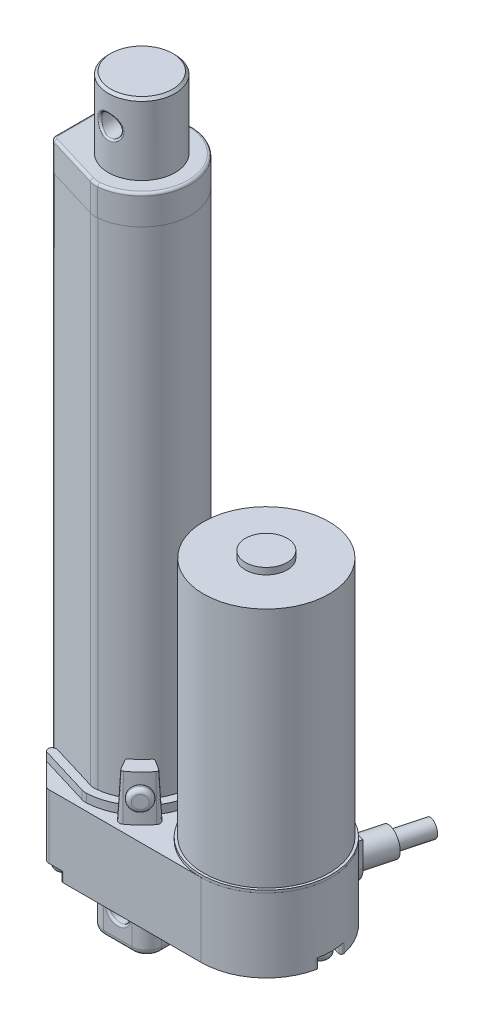
from build123d import *

# Parameters (mm, degrees)
BOSS_EXTRUDE1_DEPTH           = 22.352
BOSS_EXTRUDE2_DEPTH           = 19.05
FILLET1_R                     = 1.778
SKETCH3_R                     = 3.2385
CUT_EXTRUDE1_DEPTH            = 17.526
FILLET2_R                     = 0.635
CUT_EXTRUDE2_DEPTH            = 2.9464
FILLET3_R                     = 0.635
SKETCH5_R                     = 3.048
BOSS_EXTRUDE3_DEPTH           = 2.9464
FILLET4_R                     = 1.27
SKETCH6_R                     = 19.812
BOSS_EXTRUDE4_DEPTH           = 0.762
SKETCH7_R                     = 19.05
BOSS_EXTRUDE5_DEPTH           = 73.406
SKETCH8_R                     = 6.35
BOSS_EXTRUDE6_DEPTH           = 1.9812
BOSS_EXTRUDE8_DEPTH           = 2.54
BOSS_EXTRUDE9_DEPTH           = 13.462
BOSS_EXTRUDE9_DRAFT           = 3
BOSS_EXTRUDE9_PROFILE_2_DEPTH = 13.462
BOSS_EXTRUDE9_PROFILE_2_DRAFT = 3
FILLET6_R                     = 5.08
FILLET7_R                     = 1.905
BOSS_EXTRUDE10_DEPTH          = 152.781
BOSS_EXTRUDE11_START          = -1.27
SKETCH17_R                    = 1.905
BOSS_EXTRUDE11_DEPTH          = 7.143063
SKETCH18_R                    = 3.175
BOSS_EXTRUDE12_DEPTH          = 2.286
FILLET8_R                     = 0.508
FILLET9_R                     = 1.27
MIRROR4_OUTLINE_W             = 1.905
MIRROR4_OUTLINE_H             = 1.170431569
BOSS_EXTRUDE13_DEPTH          = 8.89
FILLET10_R                    = 0.762
SKETCH21_R                    = 10.16
BOSS_EXTRUDE14_DEPTH          = 21.59
CHAMFER1_SIZE                 = 0.762
SKETCH22_R                    = 3.2385
CUT_EXTRUDE4_DEPTH            = 20.32
FILLET11_R                    = 0.508
BOSS_EXTRUDE15_DEPTH          = 6.35
SKETCH24_R                    = 4.064
BOSS_EXTRUDE16_DEPTH          = 10.16
SKETCH25_R                    = 2.54
BOSS_EXTRUDE17_DEPTH          = 10.16


# Read off the part's stored shape, not the designer's step: Mirror4
with BuildPart() as part:
    # Sketch1 → Boss-Extrude1 (new body)
    with BuildSketch(Plane(origin=(0, 0, 0), x_dir=(1, 0, 0), z_dir=(0, 1, 0))):
        with BuildLine():
            Line((0, 30.734), (8.89, 39.624))
            Line((8.89, 39.624), (55.88, 39.624))
            ThreePointArc((55.88, 39.624), (75.692, 19.812), (55.88, 0))
            Line((55.88, 0), (8.89, 0))
            Line((8.89, 0), (0, 8.89))
            Line((0, 8.89), (0, 30.734))
        make_face()
    extrude(amount=BOSS_EXTRUDE1_DEPTH)

    # Sketch2 → Boss-Extrude2 (add)
    with BuildSketch(Plane.XZ):
        with BuildLine():
            Line((15.367, -10.922), (24.003, -10.922))
            ThreePointArc((24.003, -10.922), (27.146089642, -12.223910358), (28.448, -15.367))
            Line((28.448, -15.367), (28.448, -24.003))
            ThreePointArc((28.448, -24.003), (27.146089642, -27.146089642), (24.003, -28.448))
            Line((24.003, -28.448), (15.367, -28.448))
            ThreePointArc((15.367, -28.448), (12.223910358, -27.146089642), (10.922, -24.003))
            Line((10.922, -24.003), (10.922, -15.367))
            ThreePointArc((10.922, -15.367), (12.223910358, -12.223910358), (15.367, -10.922))
        make_face()
    extrude(amount=BOSS_EXTRUDE2_DEPTH)

    # Fillet1
    fillet1_edges = [part.edges().sort_by_distance(p)[0] for p in [
        (12.223910358, 0, -12.223910358),
        (10.922, 0, -19.685),
        (12.223910358, -19.05, -27.146089642),
        (19.685, 0, -28.448),
        (27.146089642, -19.05, -27.146089642),
        (28.448, -19.05, -19.685),
        (27.146089642, 0, -12.223910358),
        (19.685, -19.05, -10.922),
        (12.223910358, -19.05, -12.223910358),
        (10.922, -19.05, -19.685),
        (19.685, -19.05, -28.448),
        (27.146089642, -19.05, -12.223910358),
        (19.685, 0, -10.922),
        (28.448, 0, -19.685),
        (27.146089642, 0, -27.146089642),
        (12.223910358, 0, -27.146089642),
    ]]
    fillet(fillet1_edges, radius=FILLET1_R)

    # Sketch3 → Cut-Extrude1 (cut)
    with BuildSketch(Plane(origin=(0, 0, -28.448), x_dir=(-1, 0, 0), z_dir=(0, 0, -1))):
        with Locations((-19.685, -10.16)):
            Circle(SKETCH3_R)
    extrude(amount=-CUT_EXTRUDE1_DEPTH, mode=Mode.SUBTRACT)

    # Fillet2
    fillet2_edges = [part.edges().sort_by_distance(p)[0] for p in [
        (22.9235, -10.16, -28.448),
        (22.9235, -10.16, -10.922),
    ]]
    fillet(fillet2_edges, radius=FILLET2_R)

    # Sketch4 → Cut-Extrude2 (cut)
    with BuildSketch(Plane.XZ):
        with BuildLine():
            Line((73.00412155, -23.691578996), (75.435938203, -22.987))
            ThreePointArc((75.435938203, -22.987), (76.751066264, -19.812), (75.435938203, -16.637))
            Line((75.435938203, -16.637), (73.00412155, -15.932421004))
            ThreePointArc((73.00412155, -15.932421004), (67.8434, -19.812), (73.00412155, -23.691578996))
        make_face()
        with BuildLine():
            Line((6.1214, -35.1282), (2.253825694, -35.1282))
            Line((2.253825694, -35.1282), (2.253825694, -44.038030367))
            Line((2.253825694, -44.038030367), (13.272358632, -44.038030367))
            Line((13.272358632, -44.038030367), (13.272358632, -37.701818795))
            ThreePointArc((13.272358632, -37.701818795), (11.527610761, -31.32820911), (6.1214, -35.1282))
        make_face()
        with BuildLine():
            Line((6.1214, -4.4958), (0.719737432, -4.4958))
            Line((0.719737432, -4.4958), (0.719737432, 4.822320243))
            Line((0.719737432, 4.822320243), (13.272358632, 4.822320243))
            Line((13.272358632, 4.822320243), (13.272358632, -1.922181205))
            ThreePointArc((13.272358632, -1.922181205), (11.527610761, -8.29579089), (6.1214, -4.4958))
        make_face()
    extrude(amount=-CUT_EXTRUDE2_DEPTH, mode=Mode.SUBTRACT)

    # Fillet3
    fillet3_edges = [part.edges().sort_by_distance(p)[0] for p in [
        (75.435938203, 1.4732, -16.637),
        (75.435938203, 1.4732, -22.987),
        (13.272358632, 1.4732, 0),
        (4.3942, 1.4732, -4.4958),
        (4.3942, 1.4732, -35.1282),
        (13.272358632, 1.4732, -39.624),
        (13.272358632, 1.4732, -37.701818795),
        (6.1214, 1.4732, -35.1282),
        (6.1214, 1.4732, -4.4958),
        (13.272358632, 1.4732, -1.922181205),
    ]]
    fillet(fillet3_edges, radius=FILLET3_R)

    # Sketch5 → Boss-Extrude3 (add)
    with BuildSketch(Plane.XZ.offset(-2.9464)):
        with Locations(Location((71.882, -19.812, 0), (0, 0, 270))):
            Circle(SKETCH5_R)
        with Locations(Location((10.16, -4.4958, 0), (0, 0, 270))):
            Circle(SKETCH5_R)
        with Locations(Location((10.16, -35.1282, 0), (0, 0, 270))):
            Circle(SKETCH5_R)
    extrude(amount=BOSS_EXTRUDE3_DEPTH)

    # Fillet4
    fillet4_edges = [part.edges().sort_by_distance(p)[0] for p in [
        (71.882, 0, -16.764),
        (10.16, 0, -1.4478),
        (10.16, 0, -32.0802),
    ]]
    fillet(fillet4_edges, radius=FILLET4_R)

    # Sketch10 → Boss-Extrude8 (add)
    with BuildSketch(Plane(origin=(0, 22.352, 0), x_dir=(1, 0, 0), z_dir=(0, 1, 0))):
        with BuildLine():
            Line((17.356549841, 2.389752079), (1.778, 7.112))
            ThreePointArc((1.778, 7.112), (1.388665035, 7.694680953), (1.251948776, 8.382))
            ThreePointArc((1.251948776, 8.382), (1.924824623, 9.174994352), (2.957956753, 9.294325609))
            Line((2.957956753, 9.294325609), (17.347120009, 4.932610497))
            ThreePointArc((17.347120009, 4.932610497), (18.109587872, 4.77282141), (18.888242635, 4.748602532))
            ThreePointArc((18.888242635, 4.748602532), (33.1216, 19.812), (18.888242635, 34.875397468))
            ThreePointArc((18.888242635, 34.875397468), (18.109587872, 34.85117859), (17.347120009, 34.691389503))
            Line((17.347120009, 34.691389503), (2.957956753, 30.329674391))
            ThreePointArc((2.957956753, 30.329674391), (1.924824623, 30.449005648), (1.251948776, 31.242))
            ThreePointArc((1.251948776, 31.242), (1.388665035, 31.929319047), (1.778, 32.512))
            Line((1.778, 32.512), (17.356549841, 37.234247921))
            ThreePointArc((17.356549841, 37.234247921), (18.0964985, 37.391289942), (18.852360597, 37.420593575))
            ThreePointArc((18.852360597, 37.420593575), (35.6616, 19.812), (18.852360597, 2.203406425))
            ThreePointArc((18.852360597, 2.203406425), (18.0964985, 2.232710058), (17.356549841, 2.389752079))
        make_face()
    extrude(amount=BOSS_EXTRUDE8_DEPTH)


with BuildPart() as body_2:
    # Sketch6 → Boss-Extrude4 (new body)
    with BuildSketch(Plane(origin=(0, 22.352, 0), x_dir=(1, 0, 0), z_dir=(0, 1, 0))):
        with Locations(Location((55.88, 19.812, 0), (0, 0, 90))):
            Circle(SKETCH6_R)
    extrude(amount=BOSS_EXTRUDE4_DEPTH)


with BuildPart() as body_3:
    # Sketch7 → Boss-Extrude5 (new body)
    with BuildSketch(Plane(origin=(0, 23.114, 0), x_dir=(1, 0, 0), z_dir=(0, 1, 0))):
        with Locations(Location((55.88, 19.812, 0), (0, 0, 270))):
            Circle(SKETCH7_R)
    extrude(amount=BOSS_EXTRUDE5_DEPTH)

    # Sketch8 → Boss-Extrude6 (add)
    with BuildSketch(Plane(origin=(0, 96.52, 0), x_dir=(1, 0, 0), z_dir=(0, 1, 0))):
        with Locations(Location((55.88, 19.812, 0), (0, 0, 270))):
            Circle(SKETCH8_R)
    extrude(amount=BOSS_EXTRUDE6_DEPTH)


with BuildPart() as boss_extrude9_tool:
    # Sketch12 → Boss-Extrude9 (with draft: the straight prism first)
    with BuildSketch(Plane(origin=(0, 22.352, 0), x_dir=(1, 0, 0), z_dir=(0, 1, 0))):
        with BuildLine():
            ThreePointArc((32.014303654, 10.92212184), (31.026701279, 11.116715311), (30.168108753, 10.59131647))
            ThreePointArc((30.168108753, 10.59131647), (28.577297645, 8.807615657), (26.727178993, 7.294562603))
            ThreePointArc((26.727178993, 7.294562603), (26.165532827, 6.45923114), (26.317701225, 5.464208603))
            Line((26.317701225, 5.464208603), (27.9853213, 2.575805906))
            ThreePointArc((27.9853213, 2.575805906), (28.873124464, 1.91875418), (29.959174746, 2.119767149))
            ThreePointArc((29.959174746, 2.119767149), (32.794616703, 4.40586192), (35.199911367, 7.140915479))
            ThreePointArc((35.199911367, 7.140915479), (35.447198617, 8.217372837), (34.828726144, 9.132470224))
            Line((34.828726144, 9.132470224), (32.014303654, 10.92212184))
        make_face()
    extrude(amount=BOSS_EXTRUDE9_DEPTH)
    # Boss-Extrude9: the draft: its side faces are tilted about the plane it starts from
    boss_extrude9_sides = [boss_extrude9_tool.faces().sort_by_distance(p)[0] for p in [
        (35.447198617, 29.083, -8.217372837),
        (33.421514899, 29.083, -10.027296032),
        (31.026701279, 29.083, -11.116715311),
        (28.577297645, 29.083, -8.807615657),
        (26.165532827, 29.083, -6.45923114),
        (27.151511263, 29.083, -4.020007255),
        (28.873124464, 29.083, -1.91875418),
        (32.794616703, 29.083, -4.40586192),
    ]]
    draft(boss_extrude9_sides, Plane(origin=(0, 22.352, 0), x_dir=(1, 0, 0), z_dir=(0, 1, 0)), BOSS_EXTRUDE9_DRAFT)


with BuildPart() as part_1:
    add(part.part)

    # Boss-Extrude9: add boss_extrude9_tool
    add(boss_extrude9_tool.part)


with BuildPart() as boss_extrude9_profile_2_tool:
    # Sketch12 → Boss-Extrude9 profile 2 (with draft: the straight prism first)
    with BuildSketch(Plane(origin=(0, 22.352, 0), x_dir=(1, 0, 0), z_dir=(0, 1, 0))):
        with BuildLine():
            Line((32.014303654, 28.70187816), (34.828726144, 30.491529776))
            ThreePointArc((34.828726144, 30.491529776), (35.447198617, 31.406627163), (35.199911367, 32.483084521))
            ThreePointArc((35.199911367, 32.483084521), (32.794616703, 35.21813808), (29.959174746, 37.504232851))
            ThreePointArc((29.959174746, 37.504232851), (28.873124464, 37.70524582), (27.9853213, 37.048194094))
            Line((27.9853213, 37.048194094), (26.317701225, 34.159791397))
            ThreePointArc((26.317701225, 34.159791397), (26.165532827, 33.16476886), (26.727178993, 32.329437397))
            ThreePointArc((26.727178993, 32.329437397), (28.577297645, 30.816384343), (30.168108753, 29.03268353))
            ThreePointArc((30.168108753, 29.03268353), (31.026701279, 28.507284689), (32.014303654, 28.70187816))
        make_face()
    extrude(amount=BOSS_EXTRUDE9_PROFILE_2_DEPTH)
    # Boss-Extrude9 profile 2: the draft: its side faces are tilted about the plane it starts from
    boss_extrude9_profile_2_sides = [boss_extrude9_profile_2_tool.faces().sort_by_distance(p)[0] for p in [
        (31.026701279, 29.083, -28.507284689),
        (33.421514899, 29.083, -29.596703968),
        (35.447198617, 29.083, -31.406627163),
        (32.794616703, 29.083, -35.21813808),
        (28.873124464, 29.083, -37.70524582),
        (27.151511263, 29.083, -35.603992745),
        (26.165532827, 29.083, -33.16476886),
        (28.577297645, 29.083, -30.816384343),
    ]]
    draft(boss_extrude9_profile_2_sides, Plane(origin=(0, 22.352, 0), x_dir=(1, 0, 0), z_dir=(0, 1, 0)), BOSS_EXTRUDE9_PROFILE_2_DRAFT)


with BuildPart() as part_2:
    add(part_1.part)

    # Boss-Extrude9 profile 2: add boss_extrude9_profile_2_tool
    add(boss_extrude9_profile_2_tool.part)

    # Fillet6
    fillet6_edges = [part_2.edges().sort_by_distance(p)[0] for p in [
        (0, 11.176, -8.89),
        (0, 11.176, -30.734),
    ]]
    fillet(fillet6_edges, radius=FILLET6_R)

    # Fillet7
    fillet7_edges = [part_2.edges().sort_by_distance(p)[0] for p in [
        (8.89, 12.6492, 0),
        (8.89, 12.6492, -39.624),
    ]]
    fillet(fillet7_edges, radius=FILLET7_R)



with BuildPart() as body_4:
    # Sketch15 → Boss-Extrude10 (new body)
    with BuildSketch(Plane(origin=(0, 22.352, 0), x_dir=(1, 0, 0), z_dir=(0, 1, 0))):
        with BuildLine():
            Line((0, 27.937913503), (0, 11.780572688))
            ThreePointArc((0, 11.780572688), (0.348789355, 10.722914458), (1.258313758, 10.080216781))
            Line((1.258313758, 10.080216781), (16.99733119, 5.269841031))
            ThreePointArc((16.99733119, 5.269841031), (18.218857272, 5.02431986), (19.464811306, 5.022048681))
            ThreePointArc((19.464811306, 5.022048681), (32.892994534, 19.824744873), (19.439437913, 34.604384029))
            ThreePointArc((19.439437913, 34.604384029), (18.215211713, 34.60215682), (17.014164347, 34.365049304))
            Line((17.014164347, 34.365049304), (1.267095459, 29.640928638))
            ThreePointArc((1.267095459, 29.640928638), (0.351523174, 28.999255984), (0, 27.937913503))
        make_face()
    extrude(amount=BOSS_EXTRUDE10_DEPTH)


with BuildPart() as part_3:
    add(part_2.part)

    add(body_4.part)  # Boss-Extrude11 merges body 4
    # Sketch17 → Boss-Extrude11 (add)
    with BuildSketch(Plane(origin=(14.653430645, 1.06771746, 14.692278593), x_dir=(0.029251754017105197, -0.9986295347545739, 0.04339800920302793), z_dir=(-0.7052371156339636, -0.051386873151440055, -0.7071067811865513)).offset(BOSS_EXTRUDE11_START)):
        with Locations(Location((-29.464, -26.164607795, 0), (0, 0, 89.430762854))):
            Circle(SKETCH17_R)
    extrude(amount=BOSS_EXTRUDE11_DEPTH)

    # Sketch18 → Boss-Extrude12 (add)
    with BuildSketch(Plane(origin=(15.549081782, 1.132978789, 15.590304205), x_dir=(0.7089715161642867, -0.05111620054757213, -0.7033822028664737), z_dir=(0.7052371156339639, 0.051386873151440034, 0.7071067811865512))):
        with Locations(Location((24.926660212, 30.518447007, 0), (0, 0, 2.933899048))):
            Circle(SKETCH18_R)
    extrude(amount=BOSS_EXTRUDE12_DEPTH)

    # Fillet8
    fillet8_edges = [part_3.edges().sort_by_distance(p)[0] for p in [
        (30.973339782, 30.297000096, -1.912578549),
    ]]
    fillet(fillet8_edges, radius=FILLET8_R)

    # Fillet9
    fillet9_edges = [part_3.edges().sort_by_distance(p)[0] for p in [
        (32.585511828, 30.414470488, -0.296132448),
    ]]
    fillet(fillet9_edges, radius=FILLET9_R)

    # Mirror4 outline → Mirror4 (revolve)
    with BuildSketch(Plane(origin=(-2.13798856, 27.720551649, -0.117827203), x_dir=(0.7089715161642862, -0.05111620054757211, 0.7033822028664739), z_dir=(0, 0.997369802685693, 0.07248087120545527))):
        with Locations((0.9525, 43.497892183)):
            Rectangle(MIRROR4_OUTLINE_W, MIRROR4_OUTLINE_H)
        with BuildLine():
            Line((0, 49.051829107), (1.905, 49.051829107))
            Line((1.905, 49.051829107), (1.905, 50.138260795))
            Line((1.905, 50.138260795), (2.667, 50.138260795))
            ThreePointArc((2.667, 50.138260795), (3.026210245, 50.28705055), (3.175, 50.646260795))
            Line((3.175, 50.646260795), (3.175, 51.154260795))
            ThreePointArc((3.175, 51.154260795), (2.803025612, 52.052286407), (1.905, 52.424260795))
            Line((1.905, 52.424260795), (0, 52.424260795))
            Line((0, 52.424260795), (0, 49.051829107))
        make_face()
    revolve(axis=Axis((-2.13798856, 27.720551649, -0.117827203), (0.705237115633964, 0.05138687315143998, -0.7071067811865507)))

    # Sketch23 → Boss-Extrude15 (add)
    with BuildSketch(Plane(origin=(12.509172391, 0, -46.684866923), x_dir=(0, -1, 0), z_dir=(0.25881904510252135, 0, -0.9659258262890681))):
        with BuildLine():
            Line((-18.034, -53.883866243), (-10.414, -53.883866243))
            ThreePointArc((-10.414, -53.883866243), (-4.699, -48.168866243), (-10.414, -42.453866243))
            Line((-10.414, -42.453866243), (-18.034, -42.453866243))
            Line((-18.034, -42.453866243), (-18.034, -53.883866243))
        make_face()
    extrude(amount=BOSS_EXTRUDE15_DEPTH)

    # Sketch24 → Boss-Extrude16 (add)
    with BuildSketch(Plane(origin=(14.152673327, 0, -52.81849592), x_dir=(-0.9659258262890682, 0, -0.25881904510252135), z_dir=(0.2588190451025213, 0, -0.9659258262890681))):
        with Locations((-48.168866243, 10.414)):
            Circle(SKETCH24_R)
    extrude(amount=BOSS_EXTRUDE16_DEPTH)

    # Sketch25 → Boss-Extrude17 (add)
    with BuildSketch(Plane(origin=(16.782274825, 0, -62.632302315), x_dir=(-0.9659258262890681, 0, -0.25881904510252135), z_dir=(0.25881904510252135, 0, -0.9659258262890681))):
        with Locations((-48.168866243, 10.414)):
            Circle(SKETCH25_R)
    extrude(amount=BOSS_EXTRUDE17_DEPTH)


with BuildPart() as body_4_2:
    # Sketch20 → Boss-Extrude13 (new body)
    with BuildSketch(Plane(origin=(0, 175.133, 0), x_dir=(1, 0, 0), z_dir=(0, 1, 0))):
        with BuildLine():
            Line((0, 27.890676592), (0, 11.733323408))
            ThreePointArc((0, 11.733323408), (0.350154008, 10.67382361), (1.262699463, 10.031633261))
            Line((1.262699463, 10.031633261), (17.005733208, 5.264376564))
            ThreePointArc((17.005733208, 5.264376564), (18.217033021, 5.023076902), (19.452131277, 5.020827474))
            ThreePointArc((19.452131277, 5.020827474), (32.893, 19.812), (19.452131277, 34.603172526))
            ThreePointArc((19.452131277, 34.603172526), (18.217033021, 34.600923098), (17.005733208, 34.359623436))
            Line((17.005733208, 34.359623436), (1.262699463, 29.592366739))
            ThreePointArc((1.262699463, 29.592366739), (0.350154008, 28.95017639), (0, 27.890676592))
        make_face()
    extrude(amount=BOSS_EXTRUDE13_DEPTH)

    # Fillet10
    fillet10_edges = [body_4_2.edges().sort_by_distance(p)[0] for p in [
        (18.217033021, 184.023, -34.600923098),
        (9.134216335, 184.023, -31.975995087),
        (0.350154008, 184.023, -28.95017639),
        (0, 184.023, -19.812),
        (0.350154008, 184.023, -10.67382361),
        (9.134216335, 184.023, -7.648004913),
        (18.217033021, 184.023, -5.023076902),
        (32.893, 184.023, -19.812),
    ]]
    fillet(fillet10_edges, radius=FILLET10_R)

    # Sketch21 → Boss-Extrude14 (add)
    with BuildSketch(Plane(origin=(0, 184.023, 0), x_dir=(1, 0, 0), z_dir=(0, 1, 0))):
        with Locations(Location((18.034, 19.812, 0), (0, 0, 270))):
            Circle(SKETCH21_R)
    extrude(amount=BOSS_EXTRUDE14_DEPTH)

    # Chamfer1
    chamfer1_edges = [body_4_2.edges().sort_by_distance(p)[0] for p in [
        (18.034, 205.613, -29.972),
    ]]
    chamfer(chamfer1_edges, length=CHAMFER1_SIZE)

    # Sketch22 → Cut-Extrude4 (cut)
    with BuildSketch(Plane(origin=(0, 0, -29.972), x_dir=(-1, 0, 0), z_dir=(0, 0, -1))):
        with Locations(Location((-18.034, 196.215, 0), (0, 0, 270))):
            Circle(SKETCH22_R)
    extrude(amount=-CUT_EXTRUDE4_DEPTH, mode=Mode.SUBTRACT)

    # Fillet11
    fillet11_edges = [body_4_2.edges().sort_by_distance(p)[0] for p in [
        (18.034, 199.453500018, -29.97199999),
        (21.2725, 196.215, -10.181957542),
    ]]
    fillet(fillet11_edges, radius=FILLET11_R)


solid = Compound([body_2.part, body_3.part, part_3.part, body_4_2.part])
